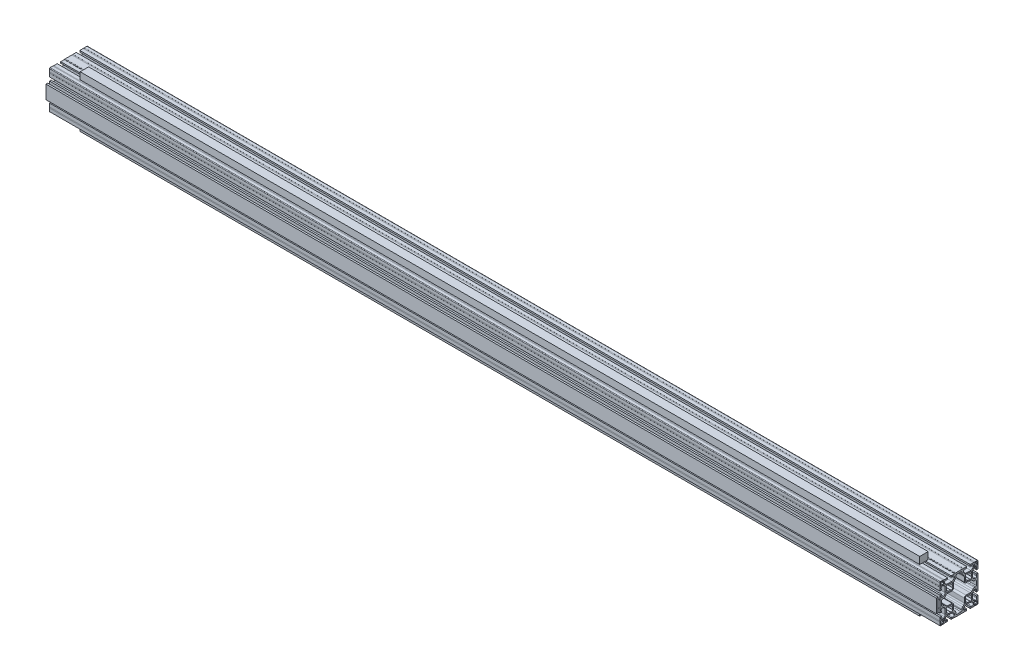
from build123d import *

# Parameters (mm, degrees)
ESQUISSE1_W             = 4
ESQUISSE1_H             = 32
BOSS_EXTRU_1_DEPTH      = 2100
BOSS_EXTRU_1_2_DEPTH    = 2100
ESQUISSE2_W             = 20
ESQUISSE2_H             = 16.5
ENL_V_MAT_EXTRU_1_DEPTH = 60
ESQUISSE3_W             = 20
ESQUISSE3_H             = 16.5
ENL_V_MAT_EXTRU_2_DEPTH = 60


with BuildPart() as part:
    # Esquisse1 → Boss.-Extru.1 (new body)
    with BuildSketch(Plane.ZY):
        with Locations((-16.500000003, -1e-08)):
            Rectangle(ESQUISSE1_W, ESQUISSE1_H)
    extrude(amount=BOSS_EXTRU_1_DEPTH)


with BuildPart() as body_2:
    # Esquisse1 → Boss.-Extru.1 2 (new body)
    with BuildSketch(Plane.ZY):
        with BuildLine():
            Line((-35.000000052, -61.000000011), (-35.000000052, -44.500000011))
            Line((-35.000000052, -44.500000011), (-32.499899985, -44.500000011))
            Line((-32.499899985, -44.500000011), (-32.499899985, -44.850000011))
            Line((-32.499899985, -44.850000011), (-30.499999985, -44.850000011))
            Line((-30.499999985, -44.850000011), (-30.499999985, -45.000000035))
            Line((-30.499999985, -45.000000035), (-23.999999985, -45.000000035))
            ThreePointArc((-23.999999985, -45.000000035), (-23.46492799, -44.901320113), (-23.000257146, -44.618263983))
            Line((-23.000257146, -44.618263983), (-23.000257146, -37.000000035))
            Line((-23.000257146, -37.000000035), (-22.649999985, -37.000000035))
            Line((-22.649999985, -37.000000035), (-22.649999985, -34.500000035))
            Line((-22.649999985, -34.500000035), (-22.499999985, -34.500000035))
            Line((-22.499999985, -34.500000035), (-22.499999985, -26.600000035))
            Line((-22.499999985, -26.600000035), (-26.200199985, -26.600000035))
            Line((-26.200199985, -26.600000035), (-26.200199985, -29.075000035))
            Line((-26.200199985, -29.075000035), (-26.000199985, -29.075000035))
            ThreePointArc((-26.000199985, -29.075000035), (-25.646646594, -29.221446645), (-25.500199985, -29.575000035))
            Line((-25.500199985, -29.575000035), (-25.500199985, -31.000000035))
            ThreePointArc((-25.500199985, -31.000000035), (-26.378879641, -33.121320379), (-28.500199985, -34.000000035))
            Line((-28.500199985, -34.000000035), (-30.550299985, -34.000000035))
            ThreePointArc((-30.550299985, -34.000000035), (-31.315632123, -33.847773485), (-31.964449526, -33.414250496))
            Line((-31.964449526, -33.414250496), (-33.735599986, -31.643100036))
            ThreePointArc((-33.735599986, -31.643100036), (-34.819416002, -30.020972887), (-35.199999986, -28.107570295))
            Line((-35.199999986, -28.107570295), (-35.199999986, -16.892400036))
            ThreePointArc((-35.199999986, -16.892400036), (-34.819300524, -14.978748396), (-33.735254217, -13.356454253))
            Line((-33.735254217, -13.356454253), (-31.964500003, -11.585800019))
            ThreePointArc((-31.964500003, -11.585800019), (-31.315676681, -11.152245019), (-30.550325061, -11.000000019))
            Line((-30.550325061, -11.000000019), (-28.500200003, -11.000000019))
            ThreePointArc((-28.500200003, -11.000000019), (-26.378879659, -11.878679675), (-25.500200003, -14.000000019))
            Line((-25.500200003, -14.000000019), (-25.500200003, -15.425000019))
            ThreePointArc((-25.500200003, -15.425000019), (-25.646646612, -15.77855341), (-26.000200003, -15.925000019))
            Line((-26.000200003, -15.925000019), (-26.200200003, -15.925000019))
            Line((-26.200200003, -15.925000019), (-26.200200003, -18.400000019))
            Line((-26.200200003, -18.400000019), (-22.500000003, -18.400000019))
            Line((-22.500000003, -18.400000019), (-22.500000003, -10.500000019))
            Line((-22.500000003, -10.500000019), (-22.650000003, -10.500000019))
            Line((-22.650000003, -10.500000019), (-22.650000003, -8.000000019))
            Line((-22.650000003, -8.000000019), (-22.500000003, -8.000000019))
            Line((-22.500000003, -8.000000019), (-22.500000003, 7.999999981))
            Line((-22.500000003, 7.999999981), (-22.650000003, 7.999999981))
            Line((-22.650000003, 7.999999981), (-22.650000003, 10.499999981))
            Line((-22.650000003, 10.499999981), (-22.500000003, 10.499999981))
            Line((-22.500000003, 10.499999981), (-22.500000003, 18.399999981))
            Line((-22.500000003, 18.399999981), (-26.200200003, 18.399999981))
            Line((-26.200200003, 18.399999981), (-26.200200003, 15.924999981))
            Line((-26.200200003, 15.924999981), (-26.000200003, 15.924999981))
            ThreePointArc((-26.000200003, 15.924999981), (-25.646646612, 15.778553372), (-25.500200003, 15.424999981))
            Line((-25.500200003, 15.424999981), (-25.500200003, 13.999999981))
            ThreePointArc((-25.500200003, 13.999999981), (-26.378879659, 11.878679637), (-28.500200003, 10.999999981))
            Line((-28.500200003, 10.999999981), (-30.550300003, 10.999999981))
            ThreePointArc((-30.550300003, 10.999999981), (-31.31560606, 11.152215729), (-31.96440962, 11.585709598))
            Line((-31.96440962, 11.585709598), (-33.735600006, 13.356799978))
            ThreePointArc((-33.735600006, 13.356799978), (-34.819417479, 14.979030648), (-35.200000007, 16.892522118))
            Line((-35.200000007, 16.892522118), (-35.200000007, 28.107599978))
            ThreePointArc((-35.200000007, 28.107599978), (-34.819380598, 30.021058356), (-33.73549012, 31.643209868))
            Line((-33.73549012, 31.643209868), (-31.964500009, 33.41419998))
            ThreePointArc((-31.964500009, 33.41419998), (-31.315676687, 33.84775498), (-30.550325067, 33.99999998))
            Line((-30.550325067, 33.99999998), (-28.500200009, 33.99999998))
            ThreePointArc((-28.500200009, 33.99999998), (-26.378879665, 33.121320324), (-25.500200009, 30.99999998))
            Line((-25.500200009, 30.99999998), (-25.500200009, 29.57499998))
            ThreePointArc((-25.500200009, 29.57499998), (-25.646646618, 29.221446589), (-26.000200009, 29.07499998))
            Line((-26.000200009, 29.07499998), (-26.200200009, 29.07499998))
            Line((-26.200200009, 29.07499998), (-26.200200009, 26.59999998))
            Line((-26.200200009, 26.59999998), (-22.500000009, 26.59999998))
            Line((-22.500000009, 26.59999998), (-22.500000009, 34.49999998))
            Line((-22.500000009, 34.49999998), (-22.650000009, 34.49999998))
            Line((-22.650000009, 34.49999998), (-22.650000009, 36.99999998))
            Line((-22.650000009, 36.99999998), (-22.495270583, 36.99999998))
            Line((-22.495270583, 36.99999998), (-22.495270583, 43.500000016))
            ThreePointArc((-22.495270583, 43.500000016), (-22.934610411, 44.560660188), (-23.995270583, 45.000000016))
            Line((-23.995270583, 45.000000016), (-30.500000009, 45.000000016))
            Line((-30.500000009, 45.000000016), (-30.500000009, 44.850000016))
            Line((-30.500000009, 44.850000016), (-32.499900009, 44.850000016))
            Line((-32.499900009, 44.850000016), (-32.499900009, 44.500000016))
            Line((-32.499900009, 44.500000016), (-35.000000031, 44.500000016))
            Line((-35.000000031, 44.500000016), (-35.000000031, 61.000000016))
            Line((-35.000000031, 61.000000016), (-55.000000031, 61.000000016))
            Line((-55.000000031, 61.000000016), (-55.000000031, 44.500000016))
            Line((-55.000000031, 44.500000016), (-57.499900008, 44.500000016))
            Line((-57.499900008, 44.500000016), (-57.499900008, 44.850000016))
            Line((-57.499900008, 44.850000016), (-59.500000008, 44.850000016))
            Line((-59.500000008, 44.850000016), (-59.500000008, 45.000000016))
            Line((-59.500000008, 45.000000016), (-75.500000008, 45.000000016))
            Line((-75.500000008, 45.000000016), (-75.500000008, 44.850000016))
            Line((-75.500000008, 44.850000016), (-78.000000008, 44.850000016))
            Line((-78.000000008, 44.850000016), (-78.000000008, 45.000000016))
            Line((-78.000000008, 45.000000016), (-85.900000008, 45.000000016))
            Line((-85.900000008, 45.000000016), (-85.900000008, 41.299800016))
            Line((-85.900000008, 41.299800016), (-83.425000008, 41.299800016))
            Line((-83.425000008, 41.299800016), (-83.425000008, 41.499799922))
            ThreePointArc((-83.425000008, 41.499799922), (-83.278553431, 41.853353373), (-82.925000008, 41.999800016))
            Line((-82.925000008, 41.999800016), (-81.500000008, 41.999800016))
            ThreePointArc((-81.500000008, 41.999800016), (-79.378679664, 41.121120359), (-78.500000008, 38.999800016))
            Line((-78.500000008, 38.999800016), (-78.500000008, 36.949700016))
            ThreePointArc((-78.500000008, 36.949700016), (-78.652226558, 36.184367878), (-79.085749547, 35.535550474))
            Line((-79.085749547, 35.535550474), (-80.856900007, 33.764400015))
            ThreePointArc((-80.856900007, 33.764400015), (-82.479027156, 32.680583999), (-84.392429748, 32.300000015))
            Line((-84.392429748, 32.300000015), (-95.607600007, 32.300000015))
            ThreePointArc((-95.607600007, 32.300000015), (-97.521251647, 32.680699477), (-99.14354579, 33.764745784))
            Line((-99.14354579, 33.764745784), (-100.914200024, 35.535499998))
            ThreePointArc((-100.914200024, 35.535499998), (-101.347755024, 36.18432332), (-101.500000024, 36.949674939))
            Line((-101.500000024, 36.949674939), (-101.500000024, 38.999799998))
            ThreePointArc((-101.500000024, 38.999799998), (-100.621320368, 41.121120341), (-98.500000024, 41.999799998))
            Line((-98.500000024, 41.999799998), (-97.075000024, 41.999799998))
            ThreePointArc((-97.075000024, 41.999799998), (-96.721446633, 41.853353388), (-96.575000024, 41.499799998))
            Line((-96.575000024, 41.499799998), (-96.575000024, 41.299799998))
            Line((-96.575000024, 41.299799998), (-94.100000024, 41.299799998))
            Line((-94.100000024, 41.299799998), (-94.100000024, 44.999999998))
            Line((-94.100000024, 44.999999998), (-102.000000024, 44.999999998))
            Line((-102.000000024, 44.999999998), (-102.000000024, 44.849999998))
            Line((-102.000000024, 44.849999998), (-104.500000024, 44.849999998))
            Line((-104.500000024, 44.849999998), (-104.500000024, 44.999999998))
            Line((-104.500000024, 44.999999998), (-111.000000024, 44.999999998))
            ThreePointArc((-111.000000024, 44.999999998), (-112.060660196, 44.56066017), (-112.500000024, 43.499999998))
            Line((-112.500000024, 43.499999998), (-112.500000024, 36.999999998))
            Line((-112.500000024, 36.999999998), (-112.350000024, 36.999999998))
            Line((-112.350000024, 36.999999998), (-112.350000024, 34.499999998))
            Line((-112.350000024, 34.499999998), (-112.500000024, 34.499999998))
            Line((-112.500000024, 34.499999998), (-112.500000024, 26.599999998))
            Line((-112.500000024, 26.599999998), (-108.799800024, 26.599999998))
            Line((-108.799800024, 26.599999998), (-108.799800024, 29.074999998))
            Line((-108.799800024, 29.074999998), (-108.999800024, 29.074999998))
            ThreePointArc((-108.999800024, 29.074999998), (-109.353353415, 29.221446607), (-109.499800024, 29.574999998))
            Line((-109.499800024, 29.574999998), (-109.499800024, 30.999999998))
            ThreePointArc((-109.499800024, 30.999999998), (-108.621120368, 33.121320341), (-106.499800024, 33.999999998))
            Line((-106.499800024, 33.999999998), (-104.449700024, 33.999999998))
            ThreePointArc((-104.449700024, 33.999999998), (-103.684367886, 33.847773447), (-103.035550483, 33.414250458))
            Line((-103.035550483, 33.414250458), (-101.264400023, 31.643099999))
            ThreePointArc((-101.264400023, 31.643099999), (-100.180584007, 30.020972849), (-99.800000023, 28.107570258))
            Line((-99.800000023, 28.107570258), (-99.800000023, 16.892399999))
            ThreePointArc((-99.800000023, 16.892399999), (-100.180699485, 14.978748358), (-101.264745792, 13.356454216))
            Line((-101.264745792, 13.356454216), (-103.035500006, 11.585799982))
            ThreePointArc((-103.035500006, 11.585799982), (-103.684323328, 11.152244982), (-104.449674948, 10.999999982))
            Line((-104.449674948, 10.999999982), (-106.499800006, 10.999999982))
            ThreePointArc((-106.499800006, 10.999999982), (-108.62112035, 11.878679638), (-109.499800006, 13.999999982))
            Line((-109.499800006, 13.999999982), (-109.499800006, 15.424999982))
            ThreePointArc((-109.499800006, 15.424999982), (-109.353353397, 15.778553372), (-108.999800006, 15.924999982))
            Line((-108.999800006, 15.924999982), (-108.799800006, 15.924999982))
            Line((-108.799800006, 15.924999982), (-108.799800006, 18.399999982))
            Line((-108.799800006, 18.399999982), (-112.500000006, 18.399999982))
            Line((-112.500000006, 18.399999982), (-112.500000006, 10.499999982))
            Line((-112.500000006, 10.499999982), (-112.350000006, 10.499999982))
            Line((-112.350000006, 10.499999982), (-112.350000006, 7.999999982))
            Line((-112.350000006, 7.999999982), (-112.500000006, 7.999999982))
            Line((-112.500000006, 7.999999982), (-112.500000006, -8.000000018))
            Line((-112.500000006, -8.000000018), (-112.350000006, -8.000000018))
            Line((-112.350000006, -8.000000018), (-112.350000006, -10.500000018))
            Line((-112.350000006, -10.500000018), (-112.500000006, -10.500000018))
            Line((-112.500000006, -10.500000018), (-112.500000006, -18.400000018))
            Line((-112.500000006, -18.400000018), (-108.799800006, -18.400000018))
            Line((-108.799800006, -18.400000018), (-108.799800006, -15.925000018))
            Line((-108.799800006, -15.925000018), (-108.999800006, -15.925000018))
            ThreePointArc((-108.999800006, -15.925000018), (-109.353353397, -15.778553409), (-109.499800006, -15.425000018))
            Line((-109.499800006, -15.425000018), (-109.499800006, -14.000000018))
            ThreePointArc((-109.499800006, -14.000000018), (-108.62112035, -11.878679675), (-106.499800006, -11.000000018))
            Line((-106.499800006, -11.000000018), (-104.449700006, -11.000000018))
            ThreePointArc((-104.449700006, -11.000000018), (-103.684393949, -11.152215766), (-103.035590389, -11.585709635))
            Line((-103.035590389, -11.585709635), (-101.264400003, -13.356800015))
            ThreePointArc((-101.264400003, -13.356800015), (-100.18058253, -14.979030686), (-99.800000002, -16.892522155))
            Line((-99.800000002, -16.892522155), (-99.800000002, -28.107600015))
            ThreePointArc((-99.800000002, -28.107600015), (-100.180619411, -30.021058393), (-101.264509889, -31.643209906))
            Line((-101.264509889, -31.643209906), (-103.0355, -33.414200017))
            ThreePointArc((-103.0355, -33.414200017), (-103.684323322, -33.847755017), (-104.449674941, -34.000000017))
            Line((-104.449674941, -34.000000017), (-106.4998, -34.000000017))
            ThreePointArc((-106.4998, -34.000000017), (-108.621120344, -33.121320361), (-109.4998, -31.000000017))
            Line((-109.4998, -31.000000017), (-109.4998, -29.575000017))
            ThreePointArc((-109.4998, -29.575000017), (-109.353353391, -29.221446627), (-108.9998, -29.075000017))
            Line((-108.9998, -29.075000017), (-108.7998, -29.075000017))
            Line((-108.7998, -29.075000017), (-108.7998, -26.600000017))
            Line((-108.7998, -26.600000017), (-112.5, -26.600000017))
            Line((-112.5, -26.600000017), (-112.5, -34.500000017))
            Line((-112.5, -34.500000017), (-112.35, -34.500000017))
            Line((-112.35, -34.500000017), (-112.35, -37.000000017))
            Line((-112.35, -37.000000017), (-112.5, -37.000000017))
            Line((-112.5, -37.000000017), (-112.5, -43.500000017))
            ThreePointArc((-112.5, -43.500000017), (-112.060660172, -44.560660189), (-111, -45.000000017))
            Line((-111, -45.000000017), (-104.5, -45.000000017))
            Line((-104.5, -45.000000017), (-104.5, -44.850000017))
            Line((-104.5, -44.850000017), (-102, -44.850000017))
            Line((-102, -44.850000017), (-102, -45.000000017))
            Line((-102, -45.000000017), (-94.1, -45.000000017))
            Line((-94.1, -45.000000017), (-94.1, -41.299800017))
            Line((-94.1, -41.299800017), (-96.575, -41.299800017))
            Line((-96.575, -41.299800017), (-96.575, -41.499800017))
            ThreePointArc((-96.575, -41.499800017), (-96.721446609, -41.853353408), (-97.075, -41.999800017))
            Line((-97.075, -41.999800017), (-98.5, -41.999800017))
            ThreePointArc((-98.5, -41.999800017), (-100.621320344, -41.121120361), (-101.5, -38.999800017))
            Line((-101.5, -38.999800017), (-101.5, -36.949700017))
            ThreePointArc((-101.5, -36.949700017), (-101.347784252, -36.18439396), (-100.914290383, -35.5355904))
            Line((-100.914290383, -35.5355904), (-99.143200003, -33.764400014))
            ThreePointArc((-99.143200003, -33.764400014), (-97.520969333, -32.680582541), (-95.607477863, -32.300000013))
            Line((-95.607477863, -32.300000013), (-84.392400003, -32.300000013))
            ThreePointArc((-84.392400003, -32.300000013), (-82.478941625, -32.680619422), (-80.856790113, -33.7645099))
            Line((-80.856790113, -33.7645099), (-79.085800001, -35.535500011))
            ThreePointArc((-79.085800001, -35.535500011), (-78.652245001, -36.184323333), (-78.500000001, -36.949674953))
            Line((-78.500000001, -36.949674953), (-78.500000001, -38.999800011))
            ThreePointArc((-78.500000001, -38.999800011), (-79.378679657, -41.121120355), (-81.500000001, -41.999800011))
            Line((-81.500000001, -41.999800011), (-82.925000001, -41.999800011))
            ThreePointArc((-82.925000001, -41.999800011), (-83.278553392, -41.853353402), (-83.425000001, -41.499800011))
            Line((-83.425000001, -41.499800011), (-83.425000001, -41.299800011))
            Line((-83.425000001, -41.299800011), (-85.900000001, -41.299800011))
            Line((-85.900000001, -41.299800011), (-85.900000001, -45.000000011))
            Line((-85.900000001, -45.000000011), (-78.000000001, -45.000000011))
            Line((-78.000000001, -45.000000011), (-78.000000001, -44.850000011))
            Line((-78.000000001, -44.850000011), (-75.500000001, -44.850000011))
            Line((-75.500000001, -44.850000011), (-75.500000001, -45.000000011))
            Line((-75.500000001, -45.000000011), (-59.500000001, -45.000000011))
            Line((-59.500000001, -45.000000011), (-59.500000001, -44.850000011))
            Line((-59.500000001, -44.850000011), (-57.499900001, -44.850000011))
            Line((-57.499900001, -44.850000011), (-57.499900001, -44.500000011))
            Line((-57.499900001, -44.500000011), (-55.000000052, -44.500000011))
            Line((-55.000000052, -44.500000011), (-55.000000052, -61.000000011))
            Line((-55.000000052, -61.000000011), (-35.000000052, -61.000000011))
        make_face()
        with BuildLine():
            Line((-29.076642797, 42.724999998), (-29.528973228, 42.724999998))
            ThreePointArc((-29.528973228, 42.724999998), (-29.541768317, 42.736749448), (-29.553862202, 42.749219485))
            ThreePointArc((-29.553862202, 42.749219485), (-31.288081889, 42.787974404), (-31.249107346, 41.053759639))
            ThreePointArc((-31.249107346, 41.053759639), (-31.23664393, 41.041687027), (-31.224900024, 41.028913406))
            Line((-31.224900024, 41.028913406), (-31.224900024, 40.576742771))
            ThreePointArc((-31.224900024, 40.576742771), (-31.399900024, 39.499999998), (-31.224900024, 38.423257224))
            Line((-31.224900024, 38.423257224), (-31.224900024, 37.971086516))
            ThreePointArc((-31.224900024, 37.971086516), (-31.236696947, 37.958258497), (-31.249219512, 37.94613782))
            ThreePointArc((-31.249219512, 37.94613782), (-31.288028161, 36.21197186), (-29.553862202, 36.25078051))
            ThreePointArc((-29.553862202, 36.25078051), (-29.54176832, 36.263250544), (-29.528973235, 36.274999992))
            Line((-29.528973235, 36.274999992), (-29.0766428, 36.274999992))
            ThreePointArc((-29.0766428, 36.274999992), (-27.999900025, 36.099999992), (-26.923157251, 36.274999991))
            Line((-26.923157251, 36.274999991), (-26.470826875, 36.274999991))
            ThreePointArc((-26.470826875, 36.274999991), (-26.458031774, 36.263250531), (-26.445937878, 36.250780484))
            ThreePointArc((-26.445937878, 36.250780484), (-24.711718185, 36.212025565), (-24.750692728, 37.946240336))
            ThreePointArc((-24.750692728, 37.946240336), (-24.763156122, 37.958312925), (-24.774900008, 37.971086519))
            Line((-24.774900008, 37.971086519), (-24.774900008, 38.423257227))
            ThreePointArc((-24.774900008, 38.423257227), (-24.599900009, 39.500000001), (-24.774900008, 40.576742774))
            Line((-24.774900008, 40.576742774), (-24.774900008, 41.028913463))
            ThreePointArc((-24.774900008, 41.028913463), (-24.763103082, 41.04174148), (-24.750580515, 41.053862156))
            ThreePointArc((-24.750580515, 41.053862156), (-24.711729908, 42.787986157), (-26.445857743, 42.749307047))
            ThreePointArc((-26.445857743, 42.749307047), (-26.457989209, 42.736790834), (-26.47082682, 42.724999998))
            Line((-26.47082682, 42.724999998), (-26.923157251, 42.724999998))
            ThreePointArc((-26.923157251, 42.724999998), (-27.999900024, 42.899999998), (-29.076642797, 42.724999998))
        make_face(mode=Mode.SUBTRACT)
        with BuildLine():
            Line((-44.999352446, -15.499999994), (-45.000647557, -15.499999994))
            ThreePointArc((-45.000647557, -15.499999994), (-46.371401346, -15.63565306), (-47.689052021, -16.037105925))
            ThreePointArc((-47.689052021, -16.037105925), (-47.873801051, -16.04900499), (-48.030362859, -15.950201184))
            ThreePointArc((-48.030362859, -15.950201184), (-51.720257272, -15.781423325), (-51.550684962, -19.471281313))
            ThreePointArc((-51.550684962, -19.471281313), (-51.451227176, -19.630065931), (-51.465364645, -19.816893494))
            ThreePointArc((-51.465364645, -19.816893494), (-52.000000025, -22.499958968), (-51.465396072, -25.183030705))
            ThreePointArc((-51.465396072, -25.183030705), (-51.451213895, -25.369880137), (-51.550662699, -25.528700097))
            ThreePointArc((-51.550662699, -25.528700097), (-51.720297792, -29.218536088), (-48.030417628, -29.049864568))
            ThreePointArc((-48.030417628, -29.049864568), (-47.873843079, -28.951005636), (-47.68905305, -28.962893575))
            ThreePointArc((-47.68905305, -28.962893575), (-45.000000154, -29.499999964), (-42.310947238, -28.962893674))
            ThreePointArc((-42.310947238, -28.962893674), (-42.126157098, -28.951005611), (-41.969582427, -29.049864574))
            ThreePointArc((-41.969582427, -29.049864574), (-38.279712507, -29.218546325), (-38.449315088, -25.528718615))
            ThreePointArc((-38.449315088, -25.528718615), (-38.548772874, -25.369933997), (-38.534635405, -25.183106435))
            ThreePointArc((-38.534635405, -25.183106435), (-38.000000025, -22.500000219), (-38.53463521, -19.816893964))
            ThreePointArc((-38.53463521, -19.816893964), (-38.548772935, -19.630066179), (-38.449315088, -19.471281313))
            ThreePointArc((-38.449315088, -19.471281313), (-38.279712501, -15.78145361), (-41.969582416, -15.950135341))
            ThreePointArc((-41.969582416, -15.950135341), (-42.126157633, -16.048994442), (-42.310948274, -16.037105823))
            ThreePointArc((-42.310948274, -16.037105823), (-43.628598811, -15.635653039), (-44.999352446, -15.499999994))
        make_face(mode=Mode.SUBTRACT)
        with BuildLine():
            Line((-29.076642797, -36.275000002), (-29.528973228, -36.275000002))
            ThreePointArc((-29.528973228, -36.275000002), (-29.541768317, -36.263250552), (-29.553862202, -36.250780515))
            ThreePointArc((-29.553862202, -36.250780515), (-31.288028161, -36.211971865), (-31.249219512, -37.946137824))
            ThreePointArc((-31.249219512, -37.946137824), (-31.236696947, -37.958258502), (-31.224900024, -37.971086521))
            Line((-31.224900024, -37.971086521), (-31.224900024, -38.423257229))
            ThreePointArc((-31.224900024, -38.423257229), (-31.399900024, -39.500000002), (-31.224900024, -40.576742776))
            Line((-31.224900024, -40.576742776), (-31.224900024, -41.028913484))
            ThreePointArc((-31.224900024, -41.028913484), (-31.236696947, -41.041741503), (-31.249219512, -41.05386218))
            ThreePointArc((-31.249219512, -41.05386218), (-31.288028161, -42.78802814), (-29.553862202, -42.74921949))
            ThreePointArc((-29.553862202, -42.74921949), (-29.541768317, -42.736749453), (-29.528973228, -42.725000002))
            Line((-29.528973228, -42.725000002), (-29.076642797, -42.725000002))
            ThreePointArc((-29.076642797, -42.725000002), (-27.999900024, -42.900000002), (-26.923157251, -42.725000002))
            Line((-26.923157251, -42.725000002), (-26.47082682, -42.725000002))
            ThreePointArc((-26.47082682, -42.725000002), (-26.458031731, -42.736749453), (-26.445937846, -42.74921949))
            ThreePointArc((-26.445937846, -42.74921949), (-24.711771887, -42.78802814), (-24.750580536, -41.05386218))
            ThreePointArc((-24.750580536, -41.05386218), (-24.763103101, -41.041741503), (-24.774900024, -41.028913484))
            Line((-24.774900024, -41.028913484), (-24.774900024, -40.576742776))
            ThreePointArc((-24.774900024, -40.576742776), (-24.599900024, -39.500000002), (-24.774900024, -38.423257229))
            Line((-24.774900024, -38.423257229), (-24.774900024, -37.971086521))
            ThreePointArc((-24.774900024, -37.971086521), (-24.763103101, -37.958258502), (-24.750580536, -37.946137824))
            ThreePointArc((-24.750580536, -37.946137824), (-24.711771887, -36.211971865), (-26.445937846, -36.250780515))
            ThreePointArc((-26.445937846, -36.250780515), (-26.458031731, -36.263250552), (-26.47082682, -36.275000002))
            Line((-26.47082682, -36.275000002), (-26.923157251, -36.275000002))
            ThreePointArc((-26.923157251, -36.275000002), (-27.999900024, -36.100000002), (-29.076642797, -36.275000002))
        make_face(mode=Mode.SUBTRACT)
        with BuildLine():
            Line((-26.500000023, -5.000000001), (-26.500000023, 4.999999999))
            ThreePointArc((-26.500000023, 4.999999999), (-27.08578646, 6.414213561), (-28.500000023, 6.999999999))
            Line((-28.500000023, 6.999999999), (-30.964470282, 6.999999999))
            ThreePointArc((-30.964470282, 6.999999999), (-32.877872873, 7.380583982), (-34.500000023, 8.464399999))
            Line((-34.500000023, 8.464399999), (-37.271226172, 11.235626148))
            ThreePointArc((-37.271226172, 11.235626148), (-38.89326968, 12.31943362), (-40.806600025, 12.699999996))
            Line((-40.806600025, 12.699999996), (-50.800000025, 12.699999996))
            ThreePointArc((-50.800000025, 12.699999996), (-53.62842715, 13.871572872), (-54.800000025, 16.699999996))
            Line((-54.800000025, 16.699999996), (-54.800000025, 26.693462643))
            ThreePointArc((-54.800000025, 26.693462643), (-55.180612525, 28.606841691), (-56.264500025, 30.228899996))
            Line((-56.264500025, 30.228899996), (-58.742748354, 32.707208327))
            ThreePointArc((-58.742748354, 32.707208327), (-60.043313058, 34.653685927), (-60.500000024, 36.949699998))
            Line((-60.500000024, 36.949699998), (-60.500000024, 38.999999998))
            ThreePointArc((-60.500000024, 38.999999998), (-61.085786462, 40.41421356), (-62.500000024, 40.999999998))
            Line((-62.500000024, 40.999999998), (-72.500000024, 40.999999998))
            ThreePointArc((-72.500000024, 40.999999998), (-73.914213586, 40.41421356), (-74.500000024, 38.999999998))
            Line((-74.500000024, 38.999999998), (-74.500000024, 36.949699998))
            ThreePointArc((-74.500000024, 36.949699998), (-74.95668699, 34.653685927), (-76.257251694, 32.707208327))
            Line((-76.257251694, 32.707208327), (-78.735500023, 30.228899996))
            ThreePointArc((-78.735500023, 30.228899996), (-79.819387523, 28.606841691), (-80.200000023, 26.693462643))
            Line((-80.200000023, 26.693462643), (-80.200000023, 16.699999996))
            ThreePointArc((-80.200000023, 16.699999996), (-81.371572898, 13.871572872), (-84.200000023, 12.699999996))
            Line((-84.200000023, 12.699999996), (-94.193462669, 12.699999996))
            ThreePointArc((-94.193462669, 12.699999996), (-96.106841718, 12.319387496), (-97.728900023, 11.235499996))
            Line((-97.728900023, 11.235499996), (-100.499890134, 8.464509885))
            ThreePointArc((-100.499890134, 8.464509885), (-102.122041647, 7.380619407), (-104.035500025, 6.999999998))
            Line((-104.035500025, 6.999999998), (-106.500000025, 6.999999998))
            ThreePointArc((-106.500000025, 6.999999998), (-107.914213587, 6.41421356), (-108.500000025, 4.999999998))
            Line((-108.500000025, 4.999999998), (-108.500000025, -5.000000002))
            ThreePointArc((-108.500000025, -5.000000002), (-107.914213587, -6.414213565), (-106.500000025, -7.000000002))
            Line((-106.500000025, -7.000000002), (-104.035500025, -7.000000002))
            ThreePointArc((-104.035500025, -7.000000002), (-102.122041647, -7.380619412), (-100.499890134, -8.464509889))
            Line((-100.499890134, -8.464509889), (-97.728900023, -11.235500001))
            ThreePointArc((-97.728900023, -11.235500001), (-96.106841718, -12.319387501), (-94.193462669, -12.700000001))
            Line((-94.193462669, -12.700000001), (-84.200000023, -12.700000001))
            ThreePointArc((-84.200000023, -12.700000001), (-81.371572898, -13.871572876), (-80.200000023, -16.700000001))
            Line((-80.200000023, -16.700000001), (-80.200000023, -26.693462647))
            ThreePointArc((-80.200000023, -26.693462647), (-79.819387523, -28.606841696), (-78.735500023, -30.228900001))
            Line((-78.735500023, -30.228900001), (-76.257251694, -32.707208332))
            ThreePointArc((-76.257251694, -32.707208332), (-74.95668699, -34.653685932), (-74.500000024, -36.949700002))
            Line((-74.500000024, -36.949700002), (-74.500000024, -39.000000002))
            ThreePointArc((-74.500000024, -39.000000002), (-73.914213586, -40.414213565), (-72.500000024, -41.000000002))
            Line((-72.500000024, -41.000000002), (-62.500000023, -41.000000002))
            ThreePointArc((-62.500000023, -41.000000002), (-61.08578646, -40.414213564), (-60.500000023, -39.000000001))
            Line((-60.500000023, -39.000000001), (-60.500000023, -36.949661777))
            ThreePointArc((-60.500000023, -36.949661777), (-60.043276429, -34.653597504), (-58.742640023, -32.707100001))
            Line((-58.742640023, -32.707100001), (-56.264331078, -30.228731053))
            ThreePointArc((-56.264331078, -30.228731053), (-55.180554823, -28.606702384), (-54.800000027, -26.693399997))
            Line((-54.800000027, -26.693399997), (-54.800000027, -16.699999997))
            ThreePointArc((-54.800000027, -16.699999997), (-53.628427151, -13.871572873), (-50.800000027, -12.699999997))
            Line((-50.800000027, -12.699999997), (-40.806600027, -12.699999997))
            ThreePointArc((-40.806600027, -12.699999997), (-38.893269681, -12.319433621), (-37.271226173, -11.235626149))
            Line((-37.271226173, -11.235626149), (-34.500109913, -8.464509888))
            ThreePointArc((-34.500109913, -8.464509888), (-32.8779584, -7.380619411), (-30.964500023, -7.000000001))
            Line((-30.964500023, -7.000000001), (-28.500000023, -7.000000001))
            ThreePointArc((-28.500000023, -7.000000001), (-27.08578646, -6.414213564), (-26.500000023, -5.000000001))
        make_face(mode=Mode.SUBTRACT)
        with BuildLine():
            Line((-40.899999985, -44.500000011), (-49.100000001, -44.500000011))
            Line((-49.100000001, -44.500000011), (-49.100000001, -41.299800011))
            Line((-49.100000001, -41.299800011), (-51.575000001, -41.299800011))
            Line((-51.575000001, -41.299800011), (-51.575000001, -41.499800011))
            ThreePointArc((-51.575000001, -41.499800011), (-51.72144661, -41.853353402), (-52.075000001, -41.999800011))
            Line((-52.075000001, -41.999800011), (-53.500000001, -41.999800011))
            ThreePointArc((-53.500000001, -41.999800011), (-55.621320345, -41.121120355), (-56.500000001, -38.999800011))
            Line((-56.500000001, -38.999800011), (-56.500000001, -36.949700011))
            ThreePointArc((-56.500000001, -36.949700011), (-56.34777345, -36.184367873), (-55.914250462, -35.53555047))
            Line((-55.914250462, -35.53555047), (-54.143100002, -33.76440001))
            ThreePointArc((-54.143100002, -33.76440001), (-52.520972852, -32.680583994), (-50.607570261, -32.30000001))
            Line((-50.607570261, -32.30000001), (-39.392400002, -32.30000001))
            ThreePointArc((-39.392400002, -32.30000001), (-37.478748361, -32.680699472), (-35.856454219, -33.764745779))
            Line((-35.856454219, -33.764745779), (-34.085799985, -35.535499993))
            ThreePointArc((-34.085799985, -35.535499993), (-33.652244985, -36.184323315), (-33.499999985, -36.949674935))
            Line((-33.499999985, -36.949674935), (-33.499999985, -38.999799993))
            ThreePointArc((-33.499999985, -38.999799993), (-34.378679641, -41.121120337), (-36.499999985, -41.999799993))
            Line((-36.499999985, -41.999799993), (-37.924999985, -41.999799993))
            ThreePointArc((-37.924999985, -41.999799993), (-38.278553375, -41.853353384), (-38.424999985, -41.499799993))
            Line((-38.424999985, -41.499799993), (-38.424999985, -41.299800011))
            Line((-38.424999985, -41.299800011), (-40.899999985, -41.299800011))
            Line((-40.899999985, -41.299800011), (-40.899999985, -44.500000011))
        make_face(mode=Mode.SUBTRACT)
        with BuildLine():
            Line((-49.100000008, 44.499999998), (-40.900000009, 44.499999998))
            Line((-40.900000009, 44.499999998), (-40.900000009, 41.299799998))
            Line((-40.900000009, 41.299799998), (-38.425000009, 41.299799998))
            Line((-38.425000009, 41.299799998), (-38.425000009, 41.499800004))
            ThreePointArc((-38.425000009, 41.499800004), (-38.278553399, 41.853353395), (-37.925000009, 41.999800004))
            Line((-37.925000009, 41.999800004), (-36.500000009, 41.999800004))
            ThreePointArc((-36.500000009, 41.999800004), (-34.378679665, 41.121120347), (-33.500000009, 38.999800004))
            Line((-33.500000009, 38.999800004), (-33.500000009, 36.949700004))
            ThreePointArc((-33.500000009, 36.949700004), (-33.652215757, 36.184393947), (-34.085709626, 35.535590387))
            Line((-34.085709626, 35.535590387), (-35.856800006, 33.764400001))
            ThreePointArc((-35.856800006, 33.764400001), (-37.479030676, 32.680582527), (-39.392522146, 32.3))
            Line((-39.392522146, 32.3), (-50.607600006, 32.3))
            ThreePointArc((-50.607600006, 32.3), (-52.521058383, 32.680619409), (-54.143209896, 33.764509886))
            Line((-54.143209896, 33.764509886), (-55.914200008, 35.535499998))
            ThreePointArc((-55.914200008, 35.535499998), (-56.347755008, 36.18432332), (-56.500000008, 36.949674939))
            Line((-56.500000008, 36.949674939), (-56.500000008, 38.999799998))
            ThreePointArc((-56.500000008, 38.999799998), (-55.621320351, 41.121120341), (-53.500000008, 41.999799998))
            Line((-53.500000008, 41.999799998), (-52.075000008, 41.999799998))
            ThreePointArc((-52.075000008, 41.999799998), (-51.721446617, 41.853353388), (-51.575000008, 41.499799998))
            Line((-51.575000008, 41.499799998), (-51.575000008, 41.299799998))
            Line((-51.575000008, 41.299799998), (-49.100000008, 41.299799998))
            Line((-49.100000008, 41.299799998), (-49.100000008, 44.499999998))
        make_face(mode=Mode.SUBTRACT)
        with BuildLine():
            ThreePointArc((-87.310948458, -16.03710579), (-88.628787258, -15.635615434), (-90.000000574, -15.500000008))
            ThreePointArc((-90.000000574, -15.500000008), (-91.371213424, -15.635615556), (-92.68905179, -16.037105864))
            ThreePointArc((-92.68905179, -16.037105864), (-92.87384243, -16.048994481), (-93.030417644, -15.950135381))
            ThreePointArc((-93.030417644, -15.950135381), (-96.72028756, -15.781453649), (-96.550684972, -19.471281353))
            ThreePointArc((-96.550684972, -19.471281353), (-96.451227187, -19.630065971), (-96.465364655, -19.816893533))
            ThreePointArc((-96.465364655, -19.816893533), (-97.000000036, -22.499999749), (-96.465364851, -25.183106003))
            ThreePointArc((-96.465364851, -25.183106003), (-96.451227126, -25.369933789), (-96.550684973, -25.528718654))
            ThreePointArc((-96.550684973, -25.528718654), (-96.720287557, -29.21854636), (-93.030417639, -29.04986462))
            ThreePointArc((-93.030417639, -29.04986462), (-92.87384267, -28.951005582), (-92.689052256, -28.962893949))
            ThreePointArc((-92.689052256, -28.962893949), (-90.000000194, -29.500000003), (-87.310948107, -28.962894071))
            ThreePointArc((-87.310948107, -28.962894071), (-87.126199045, -28.95099497), (-86.969637201, -29.049798783))
            ThreePointArc((-86.969637201, -29.049798783), (-83.279742789, -29.218576642), (-83.449315099, -25.528718654))
            ThreePointArc((-83.449315099, -25.528718654), (-83.548772884, -25.369934036), (-83.534635416, -25.183106474))
            ThreePointArc((-83.534635416, -25.183106474), (-83.000000036, -22.500040999), (-83.534603989, -19.816969263))
            ThreePointArc((-83.534603989, -19.816969263), (-83.548786166, -19.63011983), (-83.449337361, -19.47129987))
            ThreePointArc((-83.449337361, -19.47129987), (-83.279732446, -15.781433694), (-86.969637027, -15.950201024))
            ThreePointArc((-86.969637027, -15.950201024), (-87.126199099, -16.049005051), (-87.310948458, -16.03710579))
        make_face(mode=Mode.SUBTRACT)
        with BuildLine():
            ThreePointArc((-42.310948458, 28.96289421), (-43.628787145, 29.364384544), (-45.000000025, 29.499999992))
            ThreePointArc((-45.000000025, 29.499999992), (-46.371212998, 29.364384529), (-47.68905179, 28.962894137))
            ThreePointArc((-47.68905179, 28.962894137), (-47.873842429, 28.951005519), (-48.030417644, 29.049864619))
            ThreePointArc((-48.030417644, 29.049864619), (-51.72028756, 29.218546351), (-51.550684972, 25.528718647))
            ThreePointArc((-51.550684972, 25.528718647), (-51.451227187, 25.369934029), (-51.465364655, 25.183106467))
            ThreePointArc((-51.465364655, 25.183106467), (-52.000000035, 22.500000251), (-51.465364851, 19.816893996))
            ThreePointArc((-51.465364851, 19.816893996), (-51.451227126, 19.630066211), (-51.550684973, 19.471281346))
            ThreePointArc((-51.550684973, 19.471281346), (-51.720257372, 15.781423448), (-48.030363033, 15.950201021))
            ThreePointArc((-48.030363033, 15.950201021), (-47.873801307, 16.049004962), (-47.689052265, 16.037106054))
            ThreePointArc((-47.689052265, 16.037106054), (-45.000000199, 15.499999997), (-42.310948109, 16.037105929))
            ThreePointArc((-42.310948109, 16.037105929), (-42.126199046, 16.049005031), (-41.969637201, 15.950201217))
            ThreePointArc((-41.969637201, 15.950201217), (-38.279742789, 15.781423358), (-38.449315099, 19.471281346))
            ThreePointArc((-38.449315099, 19.471281346), (-38.548772884, 19.630065964), (-38.534635416, 19.816893526))
            ThreePointArc((-38.534635416, 19.816893526), (-38.000000036, 22.499959001), (-38.534603989, 25.183030737))
            ThreePointArc((-38.534603989, 25.183030737), (-38.548786166, 25.36988017), (-38.449337361, 25.52870013))
            ThreePointArc((-38.449337361, 25.52870013), (-38.279732446, 29.218566306), (-41.969637027, 29.049798976))
            ThreePointArc((-41.969637027, 29.049798976), (-42.126199099, 28.950994949), (-42.310948458, 28.96289421))
        make_face(mode=Mode.SUBTRACT)
        with BuildLine():
            ThreePointArc((-108.554062202, -36.250780515), (-110.288281889, -36.212025596), (-110.249307346, -37.946240361))
            ThreePointArc((-110.249307346, -37.946240361), (-110.159742819, -38.09892471), (-110.171951909, -38.275518178))
            ThreePointArc((-110.171951909, -38.275518178), (-110.400100056, -39.500000038), (-110.171951909, -40.724481897))
            ThreePointArc((-110.171951909, -40.724481897), (-110.159760206, -40.901149335), (-110.249419544, -41.053862216))
            ThreePointArc((-110.249419544, -41.053862216), (-110.288228194, -42.788028175), (-108.554062235, -42.749219525))
            ThreePointArc((-108.554062235, -42.749219525), (-108.401267519, -42.659664452), (-108.224581916, -42.67185189))
            ThreePointArc((-108.224581916, -42.67185189), (-107.000100056, -42.900000038), (-105.775618197, -42.67185189))
            ThreePointArc((-105.775618197, -42.67185189), (-105.598932585, -42.65966445), (-105.446137865, -42.74921953))
            ThreePointArc((-105.446137865, -42.74921953), (-103.711971906, -42.78802818), (-103.750780555, -41.053862221))
            ThreePointArc((-103.750780555, -41.053862221), (-103.840439893, -40.90114934), (-103.82824819, -40.724481903))
            ThreePointArc((-103.82824819, -40.724481903), (-103.600100042, -39.50000003), (-103.828248196, -38.275518158))
            ThreePointArc((-103.828248196, -38.275518158), (-103.840439899, -38.098850721), (-103.750780561, -37.94613784))
            ThreePointArc((-103.750780561, -37.94613784), (-103.711971911, -36.21197188), (-105.446137871, -36.25078053))
            ThreePointArc((-105.446137871, -36.25078053), (-105.598932586, -36.340335603), (-105.775618189, -36.328148165))
            ThreePointArc((-105.775618189, -36.328148165), (-107.000100035, -36.100000016), (-108.224581884, -36.32814815))
            ThreePointArc((-108.224581884, -36.32814815), (-108.401267487, -36.340335587), (-108.554062202, -36.250780515))
        make_face(mode=Mode.SUBTRACT)
        with BuildLine():
            ThreePointArc((-87.310948449, 28.962894219), (-88.628786767, 29.364384479), (-89.999998295, 29.5))
            ThreePointArc((-89.999998295, 29.5), (-91.371211778, 29.364384779), (-92.689052021, 28.962894045))
            ThreePointArc((-92.689052021, 28.962894045), (-92.873801051, 28.95099498), (-93.030362859, 29.049798785))
            ThreePointArc((-93.030362859, 29.049798785), (-96.720257272, 29.218576644), (-96.550684962, 25.528718656))
            ThreePointArc((-96.550684962, 25.528718656), (-96.451227176, 25.369934038), (-96.465364645, 25.183106476))
            ThreePointArc((-96.465364645, 25.183106476), (-97.000000025, 22.50000026), (-96.46536484, 19.816894005))
            ThreePointArc((-96.46536484, 19.816894005), (-96.451227115, 19.63006622), (-96.550684962, 19.471281355))
            ThreePointArc((-96.550684962, 19.471281355), (-96.720287545, 15.781453646), (-93.030417625, 15.950135393))
            ThreePointArc((-93.030417625, 15.950135393), (-92.873842831, 16.048994387), (-92.689052577, 16.037106197))
            ThreePointArc((-92.689052577, 16.037106197), (-90.000000313, 15.500000005), (-87.310948005, 16.037105976))
            ThreePointArc((-87.310948005, 16.037105976), (-87.126157494, 16.048994451), (-86.969582419, 15.950135386))
            ThreePointArc((-86.969582419, 15.950135386), (-83.279712502, 15.781453649), (-83.449315088, 19.471281355))
            ThreePointArc((-83.449315088, 19.471281355), (-83.548772874, 19.630065973), (-83.534635405, 19.816893535))
            ThreePointArc((-83.534635405, 19.816893535), (-83.000000025, 22.499959009), (-83.534603978, 25.183030746))
            ThreePointArc((-83.534603978, 25.183030746), (-83.548786155, 25.369880178), (-83.449337351, 25.528700138))
            ThreePointArc((-83.449337351, 25.528700138), (-83.279732436, 29.218566314), (-86.969637016, 29.049798984))
            ThreePointArc((-86.969637016, 29.049798984), (-87.126199089, 28.950994957), (-87.310948449, 28.962894219))
        make_face(mode=Mode.SUBTRACT)
        with BuildLine():
            ThreePointArc((-110.171951877, 40.724481858), (-110.400100024, 39.499948441), (-110.17191474, 38.275421944))
            ThreePointArc((-110.17191474, 38.275421944), (-110.159772, 38.098800507), (-110.24941953, 37.946137813))
            ThreePointArc((-110.24941953, 37.946137813), (-110.288270129, 36.212013805), (-108.554142288, 36.250692937))
            ThreePointArc((-108.554142288, 36.250692937), (-108.401325244, 36.340322002), (-108.224581884, 36.328148145))
            ThreePointArc((-108.224581884, 36.328148145), (-107.000100024, 36.099999998), (-105.775618164, 36.328148145))
            ThreePointArc((-105.775618164, 36.328148145), (-105.598932561, 36.340335583), (-105.446137846, 36.25078051))
            ThreePointArc((-105.446137846, 36.25078051), (-103.711971887, 36.21197186), (-103.750780536, 37.94613782))
            ThreePointArc((-103.750780536, 37.94613782), (-103.840439874, 38.098850701), (-103.828248171, 38.275518138))
            ThreePointArc((-103.828248171, 38.275518138), (-103.600100024, 39.499999998), (-103.828248171, 40.724481858))
            ThreePointArc((-103.828248171, 40.724481858), (-103.840439874, 40.901149295), (-103.750780536, 41.053862176))
            ThreePointArc((-103.750780536, 41.053862176), (-103.711971887, 42.788028135), (-105.446137846, 42.749219485))
            ThreePointArc((-105.446137846, 42.749219485), (-105.598932561, 42.659664413), (-105.775618164, 42.67185185))
            ThreePointArc((-105.775618164, 42.67185185), (-107.000100024, 42.899999998), (-108.224581884, 42.67185185))
            ThreePointArc((-108.224581884, 42.67185185), (-108.401267487, 42.659664413), (-108.554062202, 42.749219485))
            ThreePointArc((-108.554062202, 42.749219485), (-110.288228161, 42.788028135), (-110.249419512, 41.053862176))
            ThreePointArc((-110.249419512, 41.053862176), (-110.159760174, 40.901149295), (-110.171951877, 40.724481858))
        make_face(mode=Mode.SUBTRACT)
    extrude(amount=BOSS_EXTRU_1_2_DEPTH)

    # Esquisse2 → Enlèv. mat.-Extru.1 (cut)
    with BuildSketch(Plane(origin=(0, 0, 0), x_dir=(0, 0, -1), z_dir=(1, 0, 0))):
        with Locations((45.000000031, 52.750000016)):
            Rectangle(ESQUISSE2_W, ESQUISSE2_H)
        with Locations((45.000000052, -52.750000011)):
            Rectangle(ESQUISSE2_W, ESQUISSE2_H)
    extrude(amount=-ENL_V_MAT_EXTRU_1_DEPTH, mode=Mode.SUBTRACT)

    # Esquisse3 → Enlèv. mat.-Extru.2 (cut)
    with BuildSketch(Plane.ZY.offset(2100)):
        with Locations((-45.000000031, 52.750000016)):
            Rectangle(ESQUISSE3_W, ESQUISSE3_H)
        with Locations((-45.000000052, -52.750000011)):
            Rectangle(ESQUISSE3_W, ESQUISSE3_H)
    extrude(amount=-ENL_V_MAT_EXTRU_2_DEPTH, mode=Mode.SUBTRACT)


solid = Compound([part.part, body_2.part])
